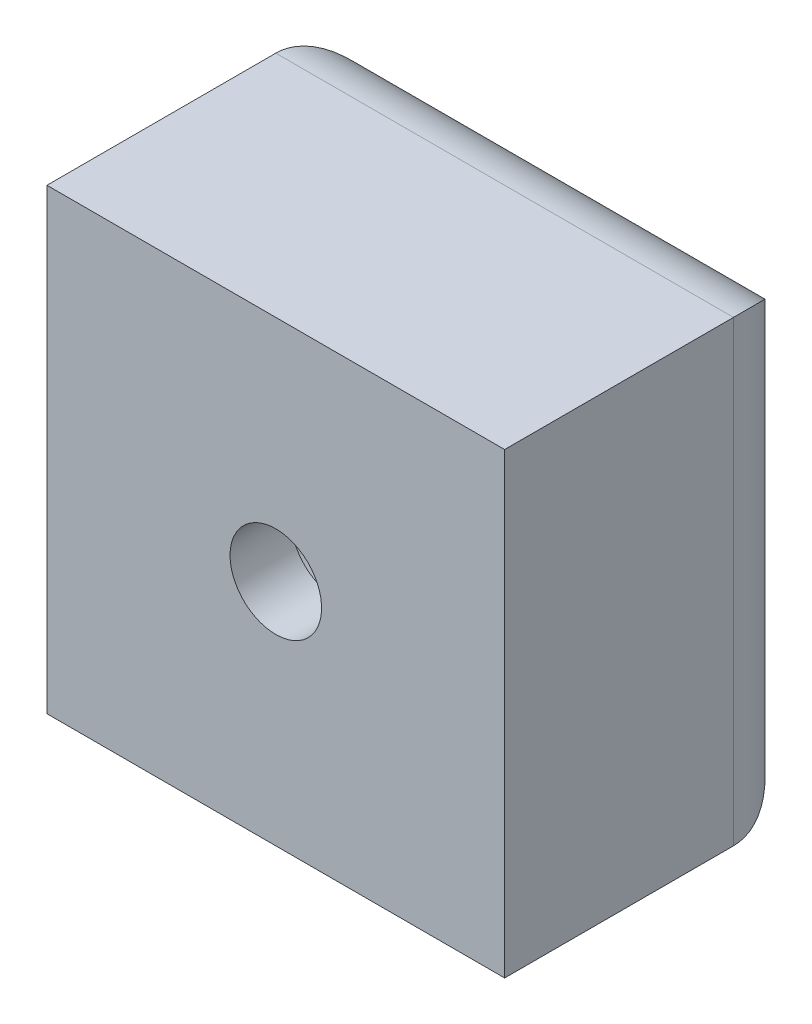
from build123d import *

# Parameters (mm, degrees)
SKETCH1_W             = 15
SKETCH1_H             = 15
BOSS_EXTRUDE1_DEPTH   = 10
FILLET2_R             = 2.5
M3X0_5_TAPPED_HOLE1_D = 3
SKETCH5_R             = 3
CUT_EXTRUDE1_DEPTH    = 8


with BuildPart() as part:
    # Sketch1 → Boss-Extrude1 (new body)
    with BuildSketch(Plane.XY):
        with Locations((7.5, 7.5)):
            Rectangle(SKETCH1_W, SKETCH1_H)
    extrude(amount=BOSS_EXTRUDE1_DEPTH)

    # Fillet2
    fillet2_edges = [part.edges().sort_by_distance(p)[0] for p in [
        (7.5, 0, 0),
        (15, 7.5, 0),
        (7.5, 15, 0),
        (0, 7.5, 0),
    ]]
    fillet(fillet2_edges, radius=FILLET2_R)

    # M3x0.5 Tapped Hole1 (through all)
    with Locations(Plane(origin=(0, 0, 0), x_dir=(-1, 0, 0), z_dir=(0, 0, -1))):
        with Locations((-7.5, 7.5)):
            Hole(M3X0_5_TAPPED_HOLE1_D / 2)

    # Sketch5 → Cut-Extrude1 (cut)
    with BuildSketch(Plane(origin=(0, 0, 0), x_dir=(-1, 0, 0), z_dir=(0, 0, -1))):
        with Locations((-7.5, 7.5)):
            Circle(SKETCH5_R)
    extrude(amount=-CUT_EXTRUDE1_DEPTH, mode=Mode.SUBTRACT)


solid = part.part
